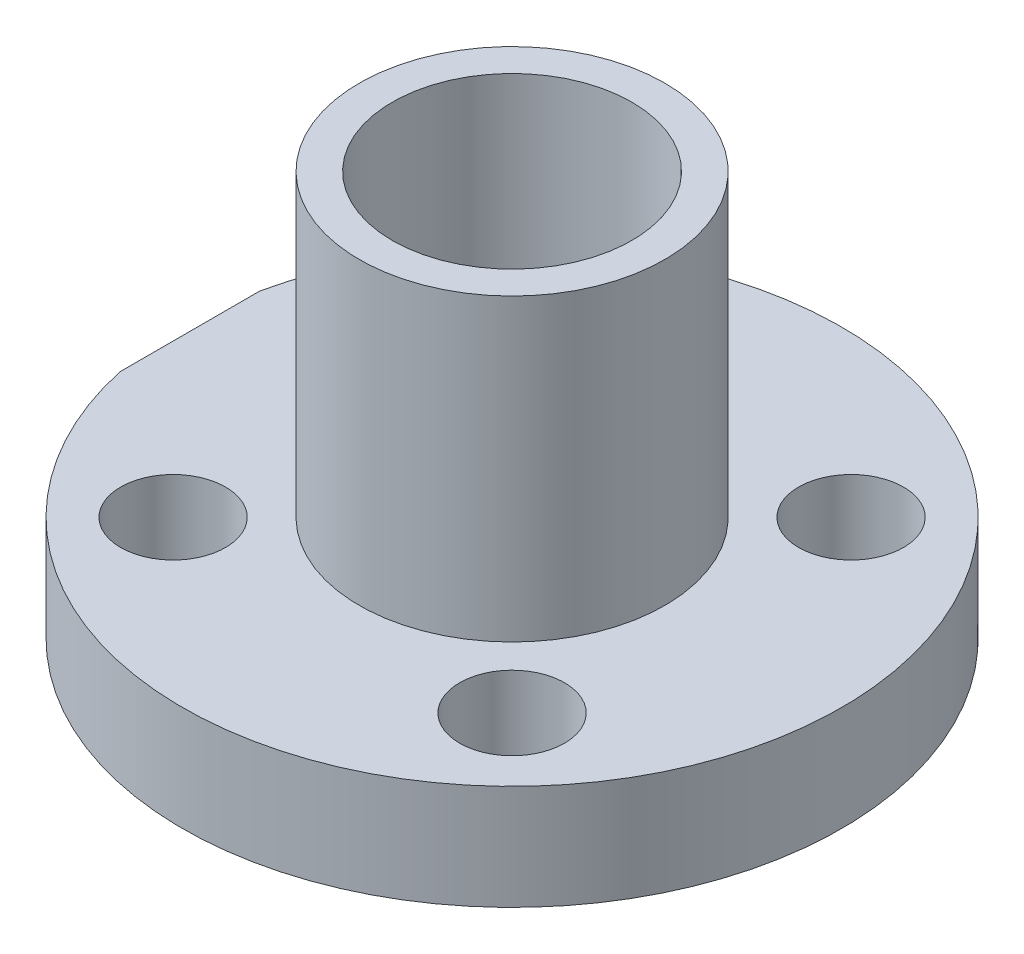
from build123d import *

# Parameters (mm, degrees)
F_3_5_3_5_DURCHMESSER_BOHRUNG1_D = 3.5
SKIZZE5_W                        = 0.5
SKIZZE5_H                        = 50
SCHNITT_LINEAR_AUSTRAGEN1_DEPTH  = 19.493242009


with BuildPart() as part:
    # Skizze1 → Rotation1 (revolve)
    with BuildSketch(Plane.XY):
        Polygon((-4, 0), (-4, 13.5), (-5.1, 13.5), (-5.1, 3.5), (-11, 3.5), (-11, 0), (-5.1, 0), (-5.1, -1.5), (-4, -1.5), align=None)
    revolve(axis=Axis((0, 0, 0), (0, 1, 0)))

    # Ø3.5 (3.5) Durchmesser Bohrung1 (through all)
    with Locations(Plane(origin=(0, 3.5, 0), x_dir=(1, 0, 0), z_dir=(0, 1, 0))):
        with Locations((5.656854249, 5.656854249), (-5.656854249, 5.656854249), (5.656854249, -5.656854249), (-5.656854249, -5.656854249)):
            Hole(F_3_5_3_5_DURCHMESSER_BOHRUNG1_D / 2)

    # Skizze5 → Schnitt-Linear austragen1 (cut, through all)
    with BuildSketch(Plane(origin=(0, 3.5, 0), x_dir=(1, 0, 0), z_dir=(0, 1, 0))):
        with Locations((-11, 0)):
            Rectangle(SKIZZE5_W, SKIZZE5_H)
    extrude(amount=-SCHNITT_LINEAR_AUSTRAGEN1_DEPTH, mode=Mode.SUBTRACT)


solid = part.part
